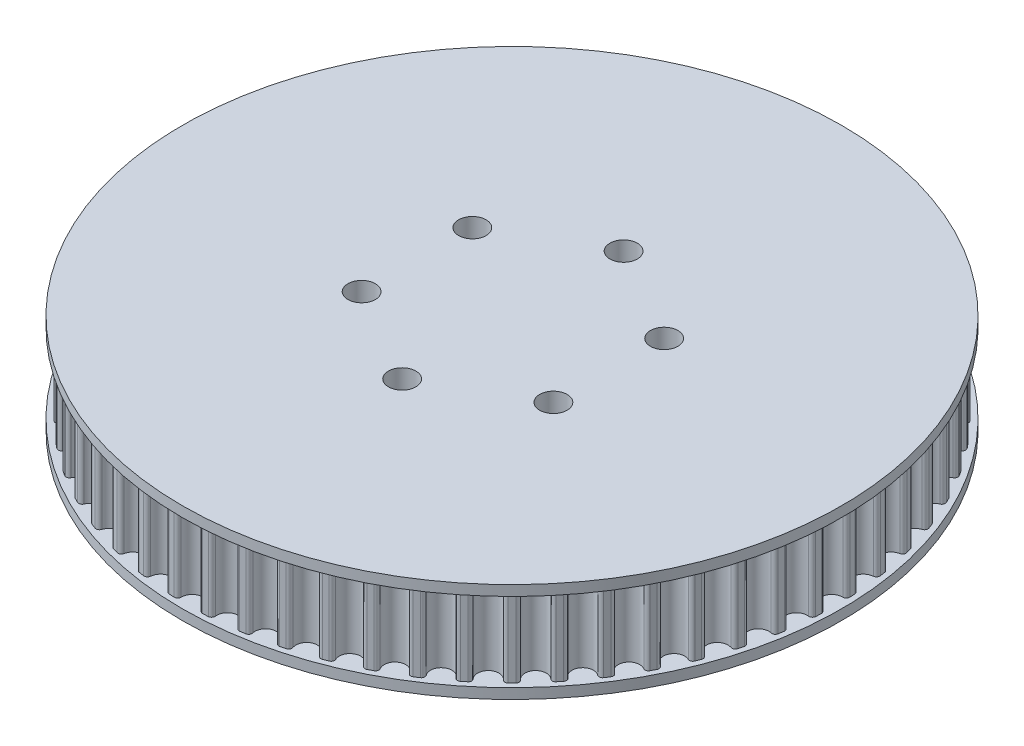
from build123d import *

# Parameters (mm, degrees)
SKETCH_1_R                       = 47.175
EXTRUDE_1_DEPTH                  = 11.5
CUT_EXTRUDE_1_DEPTH              = 68.699418387
FILLET_1_R                       = 0.5
PATTERN_CIRCULAR_1_COUNT         = 60
FILLET_1_OF_PATTERN_CIRCULAR_1_R = 0.5
SKETCH_5_R                       = 48
EXTRUDE_2_DEPTH                  = 1.5
SKETCH_6_R                       = 32.6
CUT_EXTRUDE_4_DEPTH              = 8.7
SKETCH_7_R                       = 34.1
CUT_EXTRUDE_5_DEPTH              = 1.7
EXTRUDE_START                    = 1.5
SKETCH_8_R                       = 48
EXTRUDE_3_DEPTH                  = 1.5
SKETCH_9_R                       = 22.5
CUT_EXTRUDE_7_DEPTH              = 2
SKETCH_10_R                      = 2
CUT_EXTRUDE_8_DEPTH              = 69.720375575
PATTERN_CIRCULAR_2_COUNT         = 6


with BuildPart() as part:
    # 草图1 → 凸台-拉伸1 (new body)
    with BuildSketch(Plane(origin=(0, 0, 0), x_dir=(1, 0, 0), z_dir=(0, 1, 0))):
        with Locations(Location((0, 0, 0), (0, 0, 270))):
            Circle(SKETCH_1_R)
    extrude(amount=EXTRUDE_1_DEPTH)

    # 草图2 → 切除-拉伸1 (cut, through all)
    with BuildSketch(Plane(origin=(0, 11.5, 0), x_dir=(1, 0, 0), z_dir=(0, 1, 0))):
        with BuildLine():
            ThreePointArc((1.449074704, 47.15273913), (0.72462284, 47.169434454), (0, 47.175))
            Line((0, 47.175), (0, 45.015))
            ThreePointArc((0, 45.015), (1.103086579, 45.471913421), (1.56, 46.575))
            ThreePointArc((1.56, 46.575), (1.532017712, 46.869145765), (1.449074704, 47.15273913))
        make_face()
        with BuildLine():
            Line((0, 45.015), (0, 47.175))
            ThreePointArc((0, 47.175), (-0.72462284, 47.169434454), (-1.449074704, 47.15273913))
            ThreePointArc((-1.449074704, 47.15273913), (-1.532017712, 46.869145765), (-1.56, 46.575))
            ThreePointArc((-1.56, 46.575), (-1.103086579, 45.471913421), (0, 45.015))
        make_face()
    cut_extrude_1 = extrude(amount=-CUT_EXTRUDE_1_DEPTH, mode=Mode.SUBTRACT)

    # 圆角1
    fillet_1_edges = [part.edges().sort_by_distance(p)[0] for p in [
        (-1.449074704, 5.75, -47.15273913),
        (1.449074704, 5.75, -47.15273913),
    ]]
    fillet(fillet_1_edges, radius=FILLET_1_R)

    # 阵列(圆周)1: 切除-拉伸1 ×60 about axis
    pattern_circular_1_axis = Axis((0, 0, 0), (0, 1, 0))
    for i in range(1, PATTERN_CIRCULAR_1_COUNT):
        add(cut_extrude_1.rotate(pattern_circular_1_axis, i * 360 / PATTERN_CIRCULAR_1_COUNT), mode=Mode.SUBTRACT)

    # 圆角1 of 阵列(圆周)1
    fillet_1_of_pattern_circular_1_edges = [part.edges().sort_by_distance(p)[0] for p in [
        (-6.369939881, 5.75, -46.74296194),
        (-3.487666839, 5.75, -47.045901044),
        (-11.221014664, 5.75, -45.821059077),
        (-8.386196775, 5.75, -46.42361822),
        (-15.949149662, 5.75, -44.397131102),
        (-13.192845783, 5.75, -45.292708521),
        (-20.502542439, 5.75, -42.486778867),
        (-17.854951212, 5.75, -43.665562429),
        (-24.831305071, 5.75, -40.110932593),
        (-22.32143406, 5.75, -41.560007297),
        (-28.888010728, 5.75, -37.295622547),
        (-26.543358605, 5.75, -38.999112028),
        (-32.628213294, 5.75, -34.071693857),
        (-30.474468558, 5.75, -36.010934327),
        (-36.010934327, 5.75, -30.474468558),
        (-34.071693857, 5.75, -32.628213294),
        (-38.999112028, 5.75, -26.543358605),
        (-37.295622547, 5.75, -28.888010728),
        (-41.560007297, 5.75, -22.32143406),
        (-40.110932593, 5.75, -24.831305071),
        (-43.665562429, 5.75, -17.854951212),
        (-42.486778867, 5.75, -20.502542439),
        (-45.292708521, 5.75, -13.192845783),
        (-44.397131102, 5.75, -15.949149662),
        (-46.42361822, 5.75, -8.386196775),
        (-45.821059077, 5.75, -11.221014664),
        (-47.045901044, 5.75, -3.487666839),
        (-46.74296194, 5.75, -6.369939881),
        (-47.15273913, 5.75, 1.449074704),
        (-47.15273913, 5.75, -1.449074704),
        (-46.74296194, 5.75, 6.369939881),
        (-47.045901044, 5.75, 3.487666839),
        (-45.821059077, 5.75, 11.221014664),
        (-46.42361822, 5.75, 8.386196775),
        (-44.397131102, 5.75, 15.949149662),
        (-45.292708521, 5.75, 13.192845783),
        (-42.486778867, 5.75, 20.502542439),
        (-43.665562429, 5.75, 17.854951212),
        (-40.110932593, 5.75, 24.831305071),
        (-41.560007297, 5.75, 22.32143406),
        (-37.295622547, 5.75, 28.888010728),
        (-38.999112028, 5.75, 26.543358605),
        (-34.071693857, 5.75, 32.628213294),
        (-36.010934327, 5.75, 30.474468558),
        (-30.474468558, 5.75, 36.010934327),
        (-32.628213294, 5.75, 34.071693857),
        (-26.543358605, 5.75, 38.999112028),
        (-28.888010728, 5.75, 37.295622547),
        (-22.32143406, 5.75, 41.560007297),
        (-24.831305071, 5.75, 40.110932593),
        (-17.854951212, 5.75, 43.665562429),
        (-20.502542439, 5.75, 42.486778867),
        (-13.192845783, 5.75, 45.292708521),
        (-15.949149662, 5.75, 44.397131102),
        (-8.386196775, 5.75, 46.42361822),
        (-11.221014664, 5.75, 45.821059077),
        (-3.487666839, 5.75, 47.045901044),
        (-6.369939881, 5.75, 46.74296194),
        (1.449074704, 5.75, 47.15273913),
        (-1.449074704, 5.75, 47.15273913),
        (6.369939881, 5.75, 46.74296194),
        (3.487666839, 5.75, 47.045901044),
        (11.221014664, 5.75, 45.821059077),
        (8.386196775, 5.75, 46.42361822),
        (15.949149662, 5.75, 44.397131102),
        (13.192845783, 5.75, 45.292708521),
        (20.502542439, 5.75, 42.486778867),
        (17.854951212, 5.75, 43.665562429),
        (24.831305071, 5.75, 40.110932593),
        (22.32143406, 5.75, 41.560007297),
        (28.888010728, 5.75, 37.295622547),
        (26.543358605, 5.75, 38.999112028),
        (32.628213294, 5.75, 34.071693857),
        (30.474468558, 5.75, 36.010934327),
        (36.010934327, 5.75, 30.474468558),
        (34.071693857, 5.75, 32.628213294),
        (38.999112028, 5.75, 26.543358605),
        (37.295622547, 5.75, 28.888010728),
        (41.560007297, 5.75, 22.32143406),
        (40.110932593, 5.75, 24.831305071),
        (43.665562429, 5.75, 17.854951212),
        (42.486778867, 5.75, 20.502542439),
        (45.292708521, 5.75, 13.192845783),
        (44.397131102, 5.75, 15.949149662),
        (46.42361822, 5.75, 8.386196775),
        (45.821059077, 5.75, 11.221014664),
        (47.045901044, 5.75, 3.487666839),
        (46.74296194, 5.75, 6.369939881),
        (47.15273913, 5.75, -1.449074704),
        (47.15273913, 5.75, 1.449074704),
        (46.74296194, 5.75, -6.369939881),
        (47.045901044, 5.75, -3.487666839),
        (45.821059077, 5.75, -11.221014664),
        (46.42361822, 5.75, -8.386196775),
        (44.397131102, 5.75, -15.949149662),
        (45.292708521, 5.75, -13.192845783),
        (42.486778867, 5.75, -20.502542439),
        (43.665562429, 5.75, -17.854951212),
        (40.110932593, 5.75, -24.831305071),
        (41.560007297, 5.75, -22.32143406),
        (37.295622547, 5.75, -28.888010728),
        (38.999112028, 5.75, -26.543358605),
        (34.071693857, 5.75, -32.628213294),
        (36.010934327, 5.75, -30.474468558),
        (30.474468558, 5.75, -36.010934327),
        (32.628213294, 5.75, -34.071693857),
        (26.543358605, 5.75, -38.999112028),
        (28.888010728, 5.75, -37.295622547),
        (22.32143406, 5.75, -41.560007297),
        (24.831305071, 5.75, -40.110932593),
        (17.854951212, 5.75, -43.665562429),
        (20.502542439, 5.75, -42.486778867),
        (13.192845783, 5.75, -45.292708521),
        (15.949149662, 5.75, -44.397131102),
        (8.386196775, 5.75, -46.42361822),
        (11.221014664, 5.75, -45.821059077),
        (3.487666839, 5.75, -47.045901044),
        (6.369939881, 5.75, -46.74296194),
    ]]
    fillet(fillet_1_of_pattern_circular_1_edges, radius=FILLET_1_OF_PATTERN_CIRCULAR_1_R)

    # 草图5 → 凸台-拉伸2 (add)
    with BuildSketch(Plane.XZ):
        with Locations(Location((0, 0, 0), (0, 0, 270))):
            Circle(SKETCH_5_R)
    extrude(amount=EXTRUDE_2_DEPTH)

    # 草图6 → 切除-拉伸4 (cut)
    with BuildSketch(Plane.XZ.offset(1.5)):
        with Locations(Location((0, 0, 0), (0, 0, 270))):
            Circle(SKETCH_6_R)
    extrude(amount=-CUT_EXTRUDE_4_DEPTH, mode=Mode.SUBTRACT)

    # 草图7 → 切除-拉伸5 (cut)
    with BuildSketch(Plane.XZ.offset(1.5)):
        with Locations(Location((0, 0, 0), (0, 0, 270))):
            Circle(SKETCH_7_R)
    extrude(amount=-CUT_EXTRUDE_5_DEPTH, mode=Mode.SUBTRACT)

    # 草图8 → 凸台-拉伸3 (add)
    with BuildSketch(Plane(origin=(0, 11.5, 0), x_dir=(1, 0, 0), z_dir=(0, 1, 0)).offset(EXTRUDE_START)):
        with Locations(Location((0, 0, 0), (0, 0, 90))):
            Circle(SKETCH_8_R)
    extrude(amount=-EXTRUDE_3_DEPTH)

    # 草图9 → 切除-拉伸7 (cut)
    with BuildSketch(Plane.XZ.offset(-7.2)):
        with Locations(Location((0, 0, 0), (0, 0, 270))):
            Circle(SKETCH_9_R)
    extrude(amount=-CUT_EXTRUDE_7_DEPTH, mode=Mode.SUBTRACT)

    # 草图10 → 切除-拉伸8 (cut, through all)
    with BuildSketch(Plane.XZ.offset(-9.2)):
        with Locations(Location((0, 16, 0), (0, 0, 270))):
            Circle(SKETCH_10_R)
    cut_extrude_8 = extrude(amount=-CUT_EXTRUDE_8_DEPTH, mode=Mode.SUBTRACT)

    # 阵列(圆周)2: 切除-拉伸8 ×6 about axis
    pattern_circular_2_axis = Axis((0, 0, -0.12742658), (0, 1, 0))
    for i in range(1, PATTERN_CIRCULAR_2_COUNT):
        add(cut_extrude_8.rotate(pattern_circular_2_axis, i * 360 / PATTERN_CIRCULAR_2_COUNT), mode=Mode.SUBTRACT)


solid = part.part
